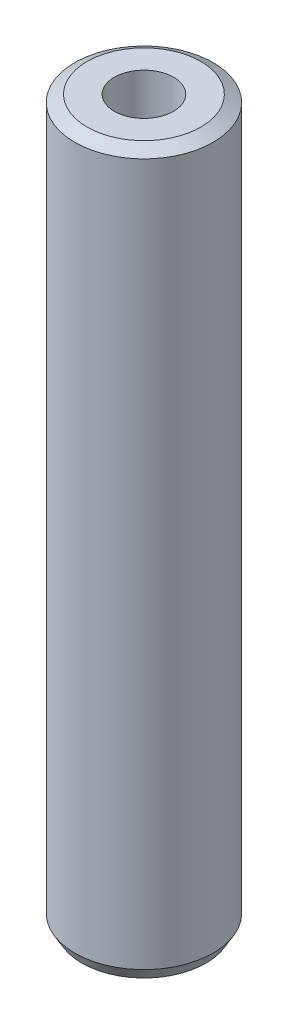
from build123d import *
from OCP.BRepFilletAPI import BRepFilletAPI_MakeChamfer

# Parameters (mm, degrees)
SKETCH1_R           = 57.5
BOSS_EXTRUDE1_DEPTH = 600
SKETCH2_R           = 24.604730791
CUT_EXTRUDE1_DEPTH  = 606.485342515
CHAMFER1_SIZE       = 5.894748555
CHAMFER1_SIZE2      = 10.210003995


with BuildPart() as part:
    # Sketch1 → Boss-Extrude1 (new body)
    with BuildSketch(Plane(origin=(0, 0, 0), x_dir=(1, 0, 0), z_dir=(0, 1, 0))):
        Circle(SKETCH1_R)
    extrude(amount=BOSS_EXTRUDE1_DEPTH)

    # Sketch2 → Cut-Extrude1 (cut, through all)
    with BuildSketch(Plane(origin=(0, 0, 0), x_dir=(1, 0, 0), z_dir=(0, 1, 0))):
        Circle(SKETCH2_R)
    extrude(amount=CUT_EXTRUDE1_DEPTH, mode=Mode.SUBTRACT)

    # Chamfer1: one chamfer whose edges measure the first distance from different faces: ONE call of the kernel's chamfer builder (chamfer() names one face for all edges)
    chamfer1_edges_1 = [part.edges().sort_by_distance(p)[0] for p in [
        (-57.5, 600, 0),
    ]]
    chamfer1_side_1 = [part.faces().sort_by_distance(p)[0] for p in [
        (-57.5, 300, 0),
    ]]
    chamfer1_edges_2 = [part.edges().sort_by_distance(p)[0] for p in [
        (-57.5, 0, 0),
    ]]
    chamfer1_side_2 = [part.faces().sort_by_distance(p)[0] for p in [
        (-55.873654403, 0, 0),
    ]]
    chamfer1 = BRepFilletAPI_MakeChamfer(part.part.solid().wrapped)
    for e in chamfer1_edges_1:
        chamfer1.Add(CHAMFER1_SIZE, CHAMFER1_SIZE2, e.wrapped, chamfer1_side_1[0].wrapped)  # the first distance lies on this face
    for e in chamfer1_edges_2:
        chamfer1.Add(CHAMFER1_SIZE, CHAMFER1_SIZE2, e.wrapped, chamfer1_side_2[0].wrapped)  # the first distance lies on this face
    add(Compound.cast(chamfer1.Shape()), mode=Mode.REPLACE)


solid = part.part
